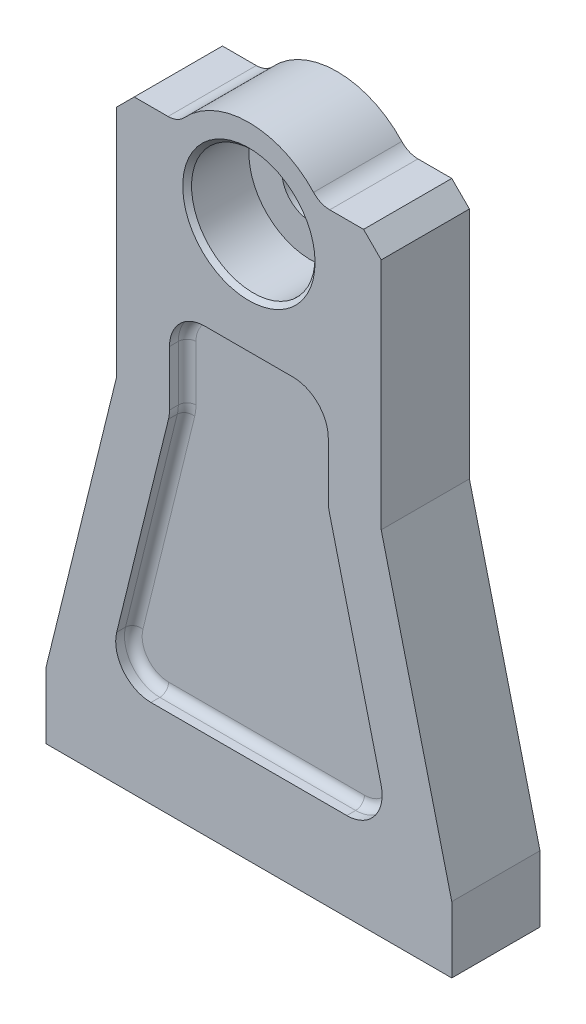
from build123d import *

# Parameters (mm, degrees)
SKETCH1_R                         = 6.5
BOSS_EXTRUDE1_DEPTH               = 10
SKETCH2_R                         = 14
CUT_EXTRUDE1_DEPTH                = 14
CHAMFER1_SIZE                     = 1
CHAMFER2_SIZE                     = 4
FILLET1_R                         = 5
CUT_EXTRUDE2_DEPTH                = 4
FILLET2_R                         = 2
FILLET2_OF_MIRROR1_R              = 2
M10X1_25_TAPPED_HOLE2_D           = 8.8
M10X1_25_TAPPED_HOLE2_DEPTH       = 20
M10X1_25_TAPPED_HOLE2_CSINK_D     = 10.05
M10X1_25_TAPPED_HOLE2_CSINK_ANGLE = 90
M10X1_25_TAPPED_HOLE2_TIP         = 2.643786724


with BuildPart() as part:
    # Sketch1 → Boss-Extrude1 (new, symmetric)
    with BuildSketch(Plane.XY):
        with BuildLine():
            Line((-46, 0), (46, 0))
            Line((46, 0), (46, 15))
            Line((46, 15), (30, 80))
            Line((30, 80), (30, 137))
            Line((30, 137), (16, 137))
            ThreePointArc((16, 137), (0, 145), (-16, 137))
            Line((-16, 137), (-30, 137))
            Line((-30, 137), (-30, 80))
            Line((-30, 80), (-46, 15))
            Line((-46, 15), (-46, 0))
        make_face()
        with Locations((0, 125)):
            Circle(SKETCH1_R, mode=Mode.SUBTRACT)
    extrude(amount=BOSS_EXTRUDE1_DEPTH, both=True)

    # Sketch2 → Cut-Extrude1 (cut)
    with BuildSketch(Plane.XY.offset(10)):
        with Locations((0, 125)):
            Circle(SKETCH2_R)
    extrude(amount=-CUT_EXTRUDE1_DEPTH, mode=Mode.SUBTRACT)

    # Chamfer1
    chamfer1_edges = [part.edges().sort_by_distance(p)[0] for p in [
        (-14, 125, 10),
    ]]
    chamfer(chamfer1_edges, length=CHAMFER1_SIZE)

    # Chamfer2
    chamfer2_edges = [part.edges().sort_by_distance(p)[0] for p in [
        (-30, 137, 0),
        (30, 137, 0),
    ]]
    chamfer(chamfer2_edges, length=CHAMFER2_SIZE)

    # Fillet1
    fillet1_edges = [part.edges().sort_by_distance(p)[0] for p in [
        (-16, 137, 0),
        (16, 137, 0),
    ]]
    fillet(fillet1_edges, radius=FILLET1_R)

    # Sketch3 → Cut-Extrude2 (cut)
    with BuildSketch(Plane.XY.offset(10)):
        with BuildLine():
            Line((-18, 92), (-18, 79.514932029))
            ThreePointArc((-18, 79.514932029), (-18.058181812, 78.55185162), (-18.231880969, 77.602779652))
            Line((-18.231880969, 77.602779652), (-29.971112298, 29.912152377))
            ThreePointArc((-29.971112298, 29.912152377), (-28.49970745, 23.065287193), (-22.202993266, 20))
            Line((-22.202993266, 20), (22.202993266, 20))
            ThreePointArc((22.202993266, 20), (28.49970745, 23.065287193), (29.971112298, 29.912152377))
            Line((29.971112298, 29.912152377), (18.231880969, 77.602779652))
            ThreePointArc((18.231880969, 77.602779652), (18.058181812, 78.55185162), (18, 79.514932029))
            Line((18, 79.514932029), (18, 92))
            ThreePointArc((18, 92), (15.656854249, 97.656854249), (10, 100))
            Line((10, 100), (-10, 100))
            ThreePointArc((-10, 100), (-15.656854249, 97.656854249), (-18, 92))
        make_face()
    cut_extrude2 = extrude(amount=-CUT_EXTRUDE2_DEPTH, mode=Mode.SUBTRACT)

    # Fillet2
    fillet2_edges = [part.edges().sort_by_distance(p)[0] for p in [
        (24.101496633, 53.757466014, 6),
        (28.49970745, 23.065287193, 6),
        (0, 20, 6),
        (-28.49970745, 23.065287193, 6),
        (-24.101496633, 53.757466014, 6),
        (-18.058181812, 78.55185162, 6),
        (-18, 85.757466014, 6),
        (-15.656854249, 97.656854249, 6),
        (0, 100, 6),
        (15.656854249, 97.656854249, 6),
        (18, 85.757466014, 6),
        (18.058181812, 78.55185162, 6),
    ]]
    fillet(fillet2_edges, radius=FILLET2_R)

    # Mirror1: Cut-Extrude2 across plane
    add(cut_extrude2.mirror(Plane.XY), mode=Mode.SUBTRACT)

    # Fillet2 of Mirror1
    fillet2_of_mirror1_edges = [part.edges().sort_by_distance(p)[0] for p in [
        (24.101496633, 53.757466014, -6),
        (28.49970745, 23.065287193, -6),
        (0, 20, -6),
        (-28.49970745, 23.065287193, -6),
        (-24.101496633, 53.757466014, -6),
        (-18.058181812, 78.55185162, -6),
        (-18, 85.757466014, -6),
        (-15.656854249, 97.656854249, -6),
        (0, 100, -6),
        (15.656854249, 97.656854249, -6),
        (18, 85.757466014, -6),
        (18.058181812, 78.55185162, -6),
    ]]
    fillet(fillet2_of_mirror1_edges, radius=FILLET2_OF_MIRROR1_R)

    # M10x1.25 Tapped Hole2
    with Locations(Plane(origin=(0, 0, 0), x_dir=(-1, 0, 0), z_dir=(0, -1, 0))):
        with Locations((-30, 0), (30, 0)):
            CounterSinkHole(M10X1_25_TAPPED_HOLE2_D / 2, M10X1_25_TAPPED_HOLE2_CSINK_D / 2, depth=M10X1_25_TAPPED_HOLE2_DEPTH, counter_sink_angle=M10X1_25_TAPPED_HOLE2_CSINK_ANGLE)
            with Locations((0, 0, -(M10X1_25_TAPPED_HOLE2_DEPTH + M10X1_25_TAPPED_HOLE2_TIP / 2))):  # 118° drill point
                Cone(0, M10X1_25_TAPPED_HOLE2_D / 2, M10X1_25_TAPPED_HOLE2_TIP, mode=Mode.SUBTRACT)


solid = part.part
